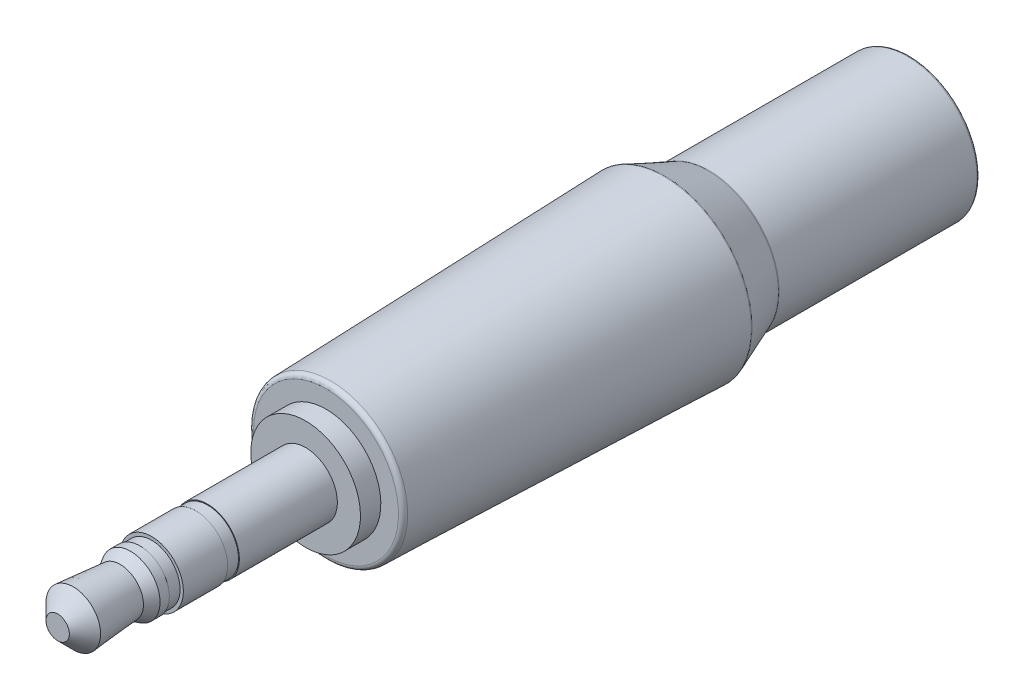
from build123d import *

# Parameters (mm, degrees)
FILLET1_R = 0.254
FILLET2_R = 0.127
FILLET3_R = 0.127
FILLET4_R = 0.127


with BuildPart() as part:
    # Sketch1 → Revolve1 (revolve)
    with BuildSketch(Plane(origin=(0, 0, 0), x_dir=(0, 0, -1), z_dir=(1, 0, 0))):
        Polygon((4.479029547, 1.6002), (3.971029547, 1.6002), (3.399106371, 1.27), (0.8509, 1.4859), (0, 0.635), (0, 0), (14.605, 0), (14.605, 2.9845), (13.496029547, 2.9845), (13.496029547, 1.7272), (8.162029547, 1.7272), (8.162029547, 1.68275), (7.527029547, 1.68275), (7.527029547, 1.7272), (5.114029547, 1.7272), (5.114029547, 1.5494), (4.479029547, 1.5494), align=None)
    revolve(axis=Axis((0, 0, 0), (0, 0, -1)))

    # Sketch2 → Revolve2 (revolve)
    with BuildSketch(Plane(origin=(0, 0, 0), x_dir=(0, 0, -1), z_dir=(1, 0, 0))):
        Polygon((14.605, 0), (14.605, 4.191), (33.02, 4.7625), (35.433, 3.81), (46.355, 3.81), (46.355, 0), align=None)
    revolve(axis=Axis((0, 0, -14.605), (0, 0, -1)))

    # Fillet1
    fillet1_edges = [part.edges().sort_by_distance(p)[0] for p in [
        (0, -4.191, -14.605),
    ]]
    fillet(fillet1_edges, radius=FILLET1_R)

    # Fillet2
    fillet2_edges = [part.edges().sort_by_distance(p)[0] for p in [
        (0, -4.7625, -33.02),
    ]]
    fillet(fillet2_edges, radius=FILLET2_R)

    # Fillet3
    fillet3_edges = [part.edges().sort_by_distance(p)[0] for p in [
        (0, -3.81, -35.433),
    ]]
    fillet(fillet3_edges, radius=FILLET3_R)

    # Fillet4
    fillet4_edges = [part.edges().sort_by_distance(p)[0] for p in [
        (0, -3.81, -46.355),
    ]]
    fillet(fillet4_edges, radius=FILLET4_R)


solid = part.part
